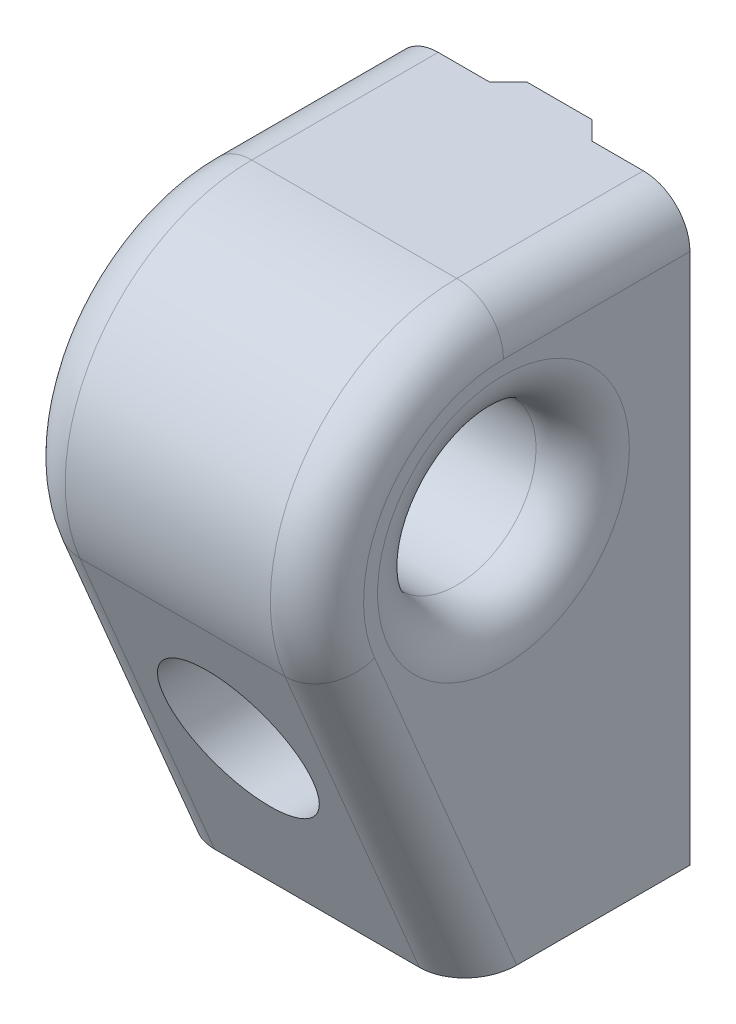
from build123d import *

# Parameters (mm, degrees)
ESQUISSE1_R             = 4.25
BOSS_EXTRU_1_DEPTH      = 8
ESQUISSE2_W             = 5.5
ESQUISSE2_H             = 31
BOSS_EXTRU_2_DEPTH      = 1
CHANFREIN1_SIZE         = 1
ESQUISSE3_R             = 2.1
ENL_V_MAT_EXTRU_1_DEPTH = 39.288379438
ENL_V_START             = -5
ESQUISSE4_R             = 4
ENL_V_MAT_EXTRU_2_DEPTH = 33.749172176
CONG_1_R                = 2.5


with BuildPart() as part:
    # Esquisse1 → Boss.-Extru.1 (new, symmetric)
    with BuildSketch(Plane(origin=(0, 0, 0), x_dir=(0, 0, -1), z_dir=(1, 0, 0))):
        with BuildLine():
            Line((0, 0), (0, 31))
            Line((0, 31), (-10, 31))
            ThreePointArc((-10, 31), (-18.331958567, 26.529779962), (-19.214779507, 17.115693286))
            Line((-19.214779507, 17.115693286), (-12, 0))
            Line((-12, 0), (0, 0))
        make_face()
        with Locations((-10, 21)):
            Circle(ESQUISSE1_R, mode=Mode.SUBTRACT)
    extrude(amount=BOSS_EXTRU_1_DEPTH, both=True)

    # Esquisse2 → Boss.-Extru.2 (add)
    with BuildSketch(Plane(origin=(0, 0, 0), x_dir=(-1, 0, 0), z_dir=(0, 0, -1))):
        with Locations((0, 15.5)):
            Rectangle(ESQUISSE2_W, ESQUISSE2_H)
    extrude(amount=BOSS_EXTRU_2_DEPTH)

    # Chanfrein1
    chanfrein1_edges = [part.edges().sort_by_distance(p)[0] for p in [
        (-2.75, 15.5, -1),
        (2.75, 15.5, -1),
    ]]
    chamfer(chanfrein1_edges, length=CHANFREIN1_SIZE - 0.0001)  # a hair under: the kernel refuses the full size

    # Esquisse3 → Enlèv. mat.-Extru.1 (cut, through all)
    with BuildSketch(Plane(origin=(0, 0, -1), x_dir=(-1, 0, 0), z_dir=(0, 0, -1))):
        with Locations(Location((0, 10, 0), (0, 0, 326.442690238))):
            Circle(ESQUISSE3_R)
    extrude(amount=-ENL_V_MAT_EXTRU_1_DEPTH, mode=Mode.SUBTRACT)

    # Esquisse4 → Enlèv. mat.-Extru.2 (cut, through all)
    with BuildSketch(Plane(origin=(0, 0, 0), x_dir=(-1, 0, 0), z_dir=(0, 0, -1)).offset(ENL_V_START)):
        with Locations((0, 10)):
            Circle(ESQUISSE4_R)
    extrude(amount=-ENL_V_MAT_EXTRU_2_DEPTH, mode=Mode.SUBTRACT)

    # Congé1
    cong_1_edges = [part.edges().sort_by_distance(p)[0] for p in [
        (8, 31, 5),
        (8, 26.529779962, 18.331958567),
        (-8, 21, 14.25),
        (8, 21, 14.25),
        (8, 8.557846643, 15.607389753),
        (-8, 8.557846643, 15.607389753),
        (-8, 26.529779962, 18.331958567),
        (-8, 31, 5),
    ]]
    fillet(cong_1_edges, radius=CONG_1_R)


solid = part.part
